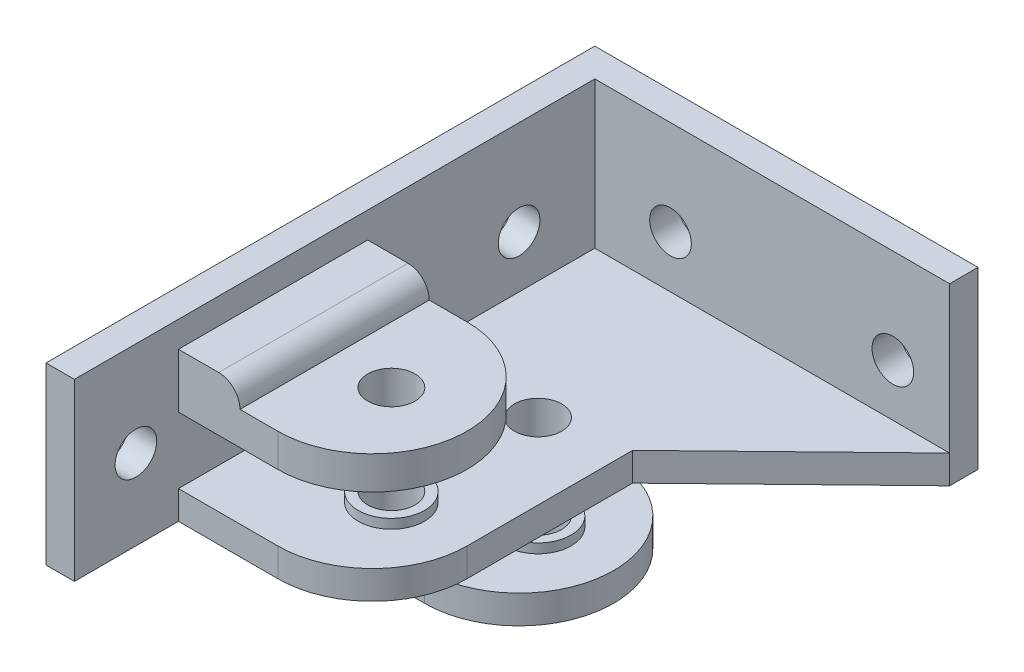
from build123d import *

# Parameters (mm, degrees)
BOSS_EXTRUDE1_DEPTH = 18.5
BOSS_EXTRUDE2_DEPTH = 3
BOSS_EXTRUDE3_START = 7
BOSS_EXTRUDE3_DEPTH = 3.5
SKETCH4_W           = 6.5
SKETCH4_H           = 2.25
BOSS_EXTRUDE4_DEPTH = 20
FILLET1_R           = 2.25
BOSS_EXTRUDE5_DEPTH = 7
BOSS_EXTRUDE6_DEPTH = 3
SKETCH7_R           = 2.5
CUT_EXTRUDE1_DEPTH  = 75.541934507
SKETCH8_R           = 2.2
CUT_EXTRUDE2_DEPTH  = 74.11976477
CUT_EXTRUDE3_REACH  = 75.12
SKETCH9_R           = 2.2
BOSS_EXTRUDE7_REACH = 77.196
SKETCH10_R          = 3.5
SKETCH10_R_2        = 2.5
BOSS_EXTRUDE8_REACH = 74.419
SKETCH11_R          = 3.5
SKETCH11_R_2        = 2.5
CUT_EXTRUDE4_REACH  = 66.742
SKETCH12_W          = 7
SKETCH12_H          = 5
CHAMFER1_SIZE       = 1.5


with BuildPart() as part:
    # Sketch1 → Boss-Extrude1 (new body)
    with BuildSketch(Plane(origin=(0, 0, 0), x_dir=(1, 0, 0), z_dir=(0, 1, 0))):
        Polygon((40.5, 0), (0, 0), (0, -58), (3, -58), (3, -3), (40.5, -3), align=None)
    extrude(amount=BOSS_EXTRUDE1_DEPTH)

    # Sketch2 → Boss-Extrude2 (add)
    with BuildSketch(Plane.XZ):
        with BuildLine():
            Line((40.5, 3), (23.5, 19.5))
            Line((23.5, 19.5), (23.5, 37))
            ThreePointArc((23.5, 37), (20.571067812, 44.071067812), (13.5, 47))
            Line((13.5, 47), (3, 47))
            Line((3, 47), (3, 3))
            Line((3, 3), (40.5, 3))
        make_face()
    extrude(amount=-BOSS_EXTRUDE2_DEPTH)

    # Sketch3 → Boss-Extrude3 (add)
    with BuildSketch(Plane(origin=(0, 3, 0), x_dir=(1, 0, 0), z_dir=(0, 1, 0)).offset(BOSS_EXTRUDE3_START)):
        with BuildLine():
            Line((3, -47), (13.5, -47))
            ThreePointArc((13.5, -47), (23.5, -37), (13.5, -27))
            Line((13.5, -27), (3, -27))
            Line((3, -27), (3, -47))
        make_face()
    extrude(amount=BOSS_EXTRUDE3_DEPTH)

    # Sketch4 → Boss-Extrude4 (add)
    with BuildSketch(Plane.XY.offset(47)):
        with Locations((6.25, 14.625)):
            Rectangle(SKETCH4_W, SKETCH4_H)
    extrude(amount=-BOSS_EXTRUDE4_DEPTH)

    # Fillet1
    fillet1_edges = [part.edges().sort_by_distance(p)[0] for p in [
        (9.5, 15.75, 37),
    ]]
    fillet(fillet1_edges, radius=FILLET1_R - 0.0001)  # a hair under: the kernel refuses the full size

    # Sketch5 → Boss-Extrude5 (add)
    with BuildSketch(Plane.XZ):
        Polygon((0, 31.5), (0, 11.5), (9, 11.5), (9, 13.5), (3, 13.5), (3, 31.5), align=None)
    extrude(amount=BOSS_EXTRUDE5_DEPTH)

    # Sketch6 → Boss-Extrude6 (add)
    with BuildSketch(Plane.XZ.offset(7)):
        with BuildLine():
            Line((0, 11.5), (0, 31.5))
            Line((0, 31.5), (13.5, 31.5))
            ThreePointArc((13.5, 31.5), (23.5, 21.5), (13.5, 11.5))
            Line((13.5, 11.5), (0, 11.5))
        make_face()
    extrude(amount=BOSS_EXTRUDE6_DEPTH)

    # Sketch7 → Cut-Extrude1 (cut, through all)
    with BuildSketch(Plane(origin=(0, 13.5, 0), x_dir=(1, 0, 0), z_dir=(0, 1, 0))):
        with Locations(Location((15.5, -21.5, 0), (0, 0, 270))):
            Circle(SKETCH7_R)
        with Locations(Location((15.5, -37, 0), (0, 0, 270))):
            Circle(SKETCH7_R)
    extrude(amount=-CUT_EXTRUDE1_DEPTH, mode=Mode.SUBTRACT)

    # Sketch8 → Cut-Extrude2 (cut, through all)
    with BuildSketch(Plane.ZY):
        with Locations((11, 8.5)):
            Circle(SKETCH8_R)
        with Locations((51.5, 8.5)):
            Circle(SKETCH8_R)
    extrude(amount=-CUT_EXTRUDE2_DEPTH, mode=Mode.SUBTRACT)

    # Sketch9 → Cut-Extrude3 (cut, up to next)
    with BuildSketch(Plane(origin=(0, 0, 0), x_dir=(-1, 0, 0), z_dir=(0, 0, -1)), mode=Mode.PRIVATE) as cut_extrude3_sk1:
        with Locations((-34.5, 8.5)):
            Circle(SKETCH9_R)
    cut_extrude3_tool1 = extrude(cut_extrude3_sk1.sketch, amount=-CUT_EXTRUDE3_REACH, mode=Mode.PRIVATE) & part.part
    # Sketch9 → Cut-Extrude3 (cut, up to next)
    with BuildSketch(Plane(origin=(0, 0, 0), x_dir=(-1, 0, 0), z_dir=(0, 0, -1)), mode=Mode.PRIVATE) as cut_extrude3_sk2:
        with Locations((-11, 8.5)):
            Circle(SKETCH9_R)
    cut_extrude3_tool2 = extrude(cut_extrude3_sk2.sketch, amount=-CUT_EXTRUDE3_REACH, mode=Mode.PRIVATE) & part.part
    add(cut_extrude3_tool1.solids().sort_by_distance((34.5, 8.5, 0))[0], mode=Mode.SUBTRACT)
    add(cut_extrude3_tool2.solids().sort_by_distance((11, 8.5, 0))[0], mode=Mode.SUBTRACT)

    # Sketch10 → Boss-Extrude7 (add, up to next)
    with BuildSketch(Plane(origin=(0, -7, 0), x_dir=(1, 0, 0), z_dir=(0, 1, 0)), mode=Mode.PRIVATE) as boss_extrude7_sk1:
        with Locations(Location((15.5, -21.5, 0), (0, 0, 270))):
            Circle(SKETCH10_R)
        with Locations(Location((15.5, -21.5, 0), (0, 0, 270))):
            Circle(SKETCH10_R_2, mode=Mode.SUBTRACT)
    boss_extrude7_tool1 = extrude(boss_extrude7_sk1.sketch, amount=BOSS_EXTRUDE7_REACH, mode=Mode.PRIVATE) - part.part
    add(boss_extrude7_tool1.solids().sort_by_distance((15.5, -7, 18.098995))[0])

    # Sketch11 → Boss-Extrude8 (add, up to next)
    with BuildSketch(Plane(origin=(0, 3, 0), x_dir=(1, 0, 0), z_dir=(0, 1, 0)), mode=Mode.PRIVATE) as boss_extrude8_sk1:
        with Locations(Location((15.5, -37, 0), (0, 0, 90))):
            Circle(SKETCH11_R)
        with Locations(Location((15.5, -37, 0), (0, 0, 270))):
            Circle(SKETCH11_R_2, mode=Mode.SUBTRACT)
    boss_extrude8_tool1 = extrude(boss_extrude8_sk1.sketch, amount=BOSS_EXTRUDE8_REACH, mode=Mode.PRIVATE) - part.part
    add(boss_extrude8_tool1.solids().sort_by_distance((15.5, 3, 40.401005))[0])

    # Cut-Extrude4: up to this face of the body (flat: up to its plane)
    cut_extrude4_end = Plane(part.part.faces().sort_by_distance((21.694792225, 10.874217494, 3))[0])
    # Sketch12 → Cut-Extrude4 (cut, up to the picked face)
    with BuildSketch(Plane.XY.offset(47), mode=Mode.PRIVATE) as cut_extrude4_sk1:
        with Locations((15.5, -3.5)):
            Rectangle(SKETCH12_W, SKETCH12_H)
    cut_extrude4_tool1 = split(extrude(cut_extrude4_sk1.sketch, amount=-CUT_EXTRUDE4_REACH, mode=Mode.PRIVATE), bisect_by=cut_extrude4_end, keep=Keep.BOTH, mode=Mode.PRIVATE)
    # Sketch12 → Cut-Extrude4 (cut, up to the picked face)
    with BuildSketch(Plane.XY.offset(47), mode=Mode.PRIVATE) as cut_extrude4_sk2:
        with Locations((15.5, 6.5)):
            Rectangle(SKETCH12_W, SKETCH12_H)
    cut_extrude4_tool2 = split(extrude(cut_extrude4_sk2.sketch, amount=-CUT_EXTRUDE4_REACH, mode=Mode.PRIVATE), bisect_by=cut_extrude4_end, keep=Keep.BOTH, mode=Mode.PRIVATE)
    add(cut_extrude4_tool1.solids().sort_by(Axis((15.5, -3.5, 47), (0, 0, -1)))[0], mode=Mode.SUBTRACT)
    add(cut_extrude4_tool2.solids().sort_by(Axis((15.5, 6.5, 47), (0, 0, -1)))[0], mode=Mode.SUBTRACT)

    # Chamfer1
    chamfer1_edges = [part.edges().sort_by_distance(p)[0] for p in [
        (9, -3.5, 13.5),
    ]]
    chamfer(chamfer1_edges, length=CHAMFER1_SIZE)


solid = part.part
